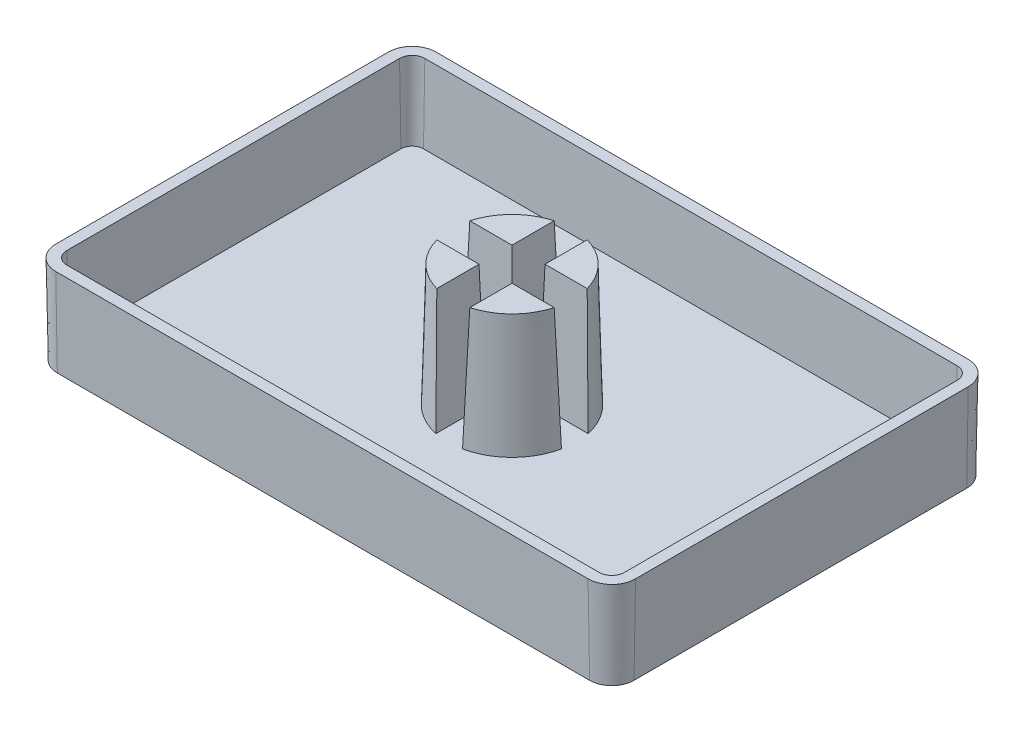
from build123d import *

# Parameters (mm, degrees)
BOSS_EXTRUDE1_DEPTH           = 4
BOSS_EXTRUDE1_DRAFT           = -1
SHELL1_T                      = -0.5
BOSS_EXTRUDE2_DEPTH           = 5.5
BOSS_EXTRUDE2_DRAFT           = 1.5
BOSS_EXTRUDE2_PROFILE_2_DEPTH = 5.5
BOSS_EXTRUDE2_PROFILE_2_DRAFT = 1.5
BOSS_EXTRUDE2_PROFILE_3_DEPTH = 5.5
BOSS_EXTRUDE2_PROFILE_3_DRAFT = 1.5
BOSS_EXTRUDE2_PROFILE_4_DEPTH = 5.5
BOSS_EXTRUDE2_PROFILE_4_DRAFT = 1.5


with BuildPart() as part:
    # Sketch1 → Boss-Extrude1 (with draft: the straight prism first)
    with BuildSketch(Plane(origin=(0, 0, 0), x_dir=(1, 0, 0), z_dir=(0, 1, 0))):
        with BuildLine():
            Line((-12, -8.5), (12, -8.5))
            ThreePointArc((12, -8.5), (12.707106781, -8.207106781), (13, -7.5))
            Line((13, -7.5), (13, 7.5))
            ThreePointArc((13, 7.5), (12.707106781, 8.207106781), (12, 8.5))
            Line((12, 8.5), (-12, 8.5))
            ThreePointArc((-12, 8.5), (-12.707106781, 8.207106781), (-13, 7.5))
            Line((-13, 7.5), (-13, -7.5))
            ThreePointArc((-13, -7.5), (-12.707106781, -8.207106781), (-12, -8.5))
        make_face()
    extrude(amount=BOSS_EXTRUDE1_DEPTH)
    # Boss-Extrude1: the draft: its side faces are tilted about the plane it starts from
    boss_extrude1_sides = [part.faces().sort_by_distance(p)[0] for p in [
        (0, 2, 8.5),
        (12.707106781, 2, 8.207106781),
        (13, 2, 0),
        (12.707106781, 2, -8.207106781),
        (0, 2, -8.5),
        (-12.707106781, 2, -8.207106781),
        (-13, 2, 0),
        (-12.707106781, 2, 8.207106781),
    ]]
    draft(boss_extrude1_sides, Plane(origin=(0, 0, 0), x_dir=(1, 0, 0), z_dir=(0, 1, 0)), BOSS_EXTRUDE1_DRAFT)

    # Shell1
    shell1_openings = [part.faces().sort_by_distance(p)[0] for p in [
        (0, 4, 0),
    ]]
    offset(amount=SHELL1_T, openings=shell1_openings, kind=Kind.INTERSECTION)


with BuildPart() as boss_extrude2_tool:
    # Sketch2 → Boss-Extrude2 (with draft: the straight prism first)
    with BuildSketch(Plane(origin=(0, 0.5, 0), x_dir=(1, 0, 0), z_dir=(0, 1, 0))):
        with BuildLine():
            Line((-0.6, -2.829761289), (-0.6, -0.6))
            Line((-0.6, -0.6), (-2.829761289, -0.6))
            ThreePointArc((-2.829761289, -0.6), (-2.0454277, -2.0454277), (-0.6, -2.829761289))
        make_face()
    extrude(amount=BOSS_EXTRUDE2_DEPTH)
    # Boss-Extrude2: the draft: its side faces are tilted about the plane it starts from
    boss_extrude2_sides = [boss_extrude2_tool.faces().sort_by_distance(p)[0] for p in [
        (-0.6, 3.25, 1.714880645),
        (-1.714880645, 3.25, 0.6),
        (-2.0454277, 3.25, 2.0454277),
    ]]
    draft(boss_extrude2_sides, Plane(origin=(0, 0.5, 0), x_dir=(1, 0, 0), z_dir=(0, 1, 0)), BOSS_EXTRUDE2_DRAFT)


with BuildPart() as part_1:
    add(part.part)

    # Boss-Extrude2: add boss_extrude2_tool
    add(boss_extrude2_tool.part)


with BuildPart() as boss_extrude2_profile_2_tool:
    # Sketch2 → Boss-Extrude2 profile 2 (with draft: the straight prism first)
    with BuildSketch(Plane(origin=(0, 0.5, 0), x_dir=(1, 0, 0), z_dir=(0, 1, 0))):
        with BuildLine():
            ThreePointArc((2.829761289, 0.6), (2.0454277, 2.0454277), (0.6, 2.829761289))
            Line((0.6, 2.829761289), (0.6, 0.6))
            Line((0.6, 0.6), (2.829761289, 0.6))
        make_face()
    extrude(amount=BOSS_EXTRUDE2_PROFILE_2_DEPTH)
    # Boss-Extrude2 profile 2: the draft: its side faces are tilted about the plane it starts from
    boss_extrude2_profile_2_sides = [boss_extrude2_profile_2_tool.faces().sort_by_distance(p)[0] for p in [
        (2.0454277, 3.25, -2.0454277),
        (0.6, 3.25, -1.714880645),
        (1.714880645, 3.25, -0.6),
    ]]
    draft(boss_extrude2_profile_2_sides, Plane(origin=(0, 0.5, 0), x_dir=(1, 0, 0), z_dir=(0, 1, 0)), BOSS_EXTRUDE2_PROFILE_2_DRAFT)


with BuildPart() as part_2:
    add(part_1.part)

    # Boss-Extrude2 profile 2: add boss_extrude2_profile_2_tool
    add(boss_extrude2_profile_2_tool.part)


with BuildPart() as boss_extrude2_profile_3_tool:
    # Sketch2 → Boss-Extrude2 profile 3 (with draft: the straight prism first)
    with BuildSketch(Plane(origin=(0, 0.5, 0), x_dir=(1, 0, 0), z_dir=(0, 1, 0))):
        with BuildLine():
            Line((2.829761289, -0.6), (0.6, -0.6))
            Line((0.6, -0.6), (0.6, -2.829761289))
            ThreePointArc((0.6, -2.829761289), (2.0454277, -2.0454277), (2.829761289, -0.6))
        make_face()
    extrude(amount=BOSS_EXTRUDE2_PROFILE_3_DEPTH)
    # Boss-Extrude2 profile 3: the draft: its side faces are tilted about the plane it starts from
    boss_extrude2_profile_3_sides = [boss_extrude2_profile_3_tool.faces().sort_by_distance(p)[0] for p in [
        (1.714880645, 3.25, 0.6),
        (0.6, 3.25, 1.714880645),
        (2.0454277, 3.25, 2.0454277),
    ]]
    draft(boss_extrude2_profile_3_sides, Plane(origin=(0, 0.5, 0), x_dir=(1, 0, 0), z_dir=(0, 1, 0)), BOSS_EXTRUDE2_PROFILE_3_DRAFT)


with BuildPart() as part_3:
    add(part_2.part)

    # Boss-Extrude2 profile 3: add boss_extrude2_profile_3_tool
    add(boss_extrude2_profile_3_tool.part)


with BuildPart() as boss_extrude2_profile_4_tool:
    # Sketch2 → Boss-Extrude2 profile 4 (with draft: the straight prism first)
    with BuildSketch(Plane(origin=(0, 0.5, 0), x_dir=(1, 0, 0), z_dir=(0, 1, 0))):
        with BuildLine():
            Line((-0.6, 0.6), (-0.6, 2.829761289))
            ThreePointArc((-0.6, 2.829761289), (-2.0454277, 2.0454277), (-2.829761289, 0.6))
            Line((-2.829761289, 0.6), (-0.6, 0.6))
        make_face()
    extrude(amount=BOSS_EXTRUDE2_PROFILE_4_DEPTH)
    # Boss-Extrude2 profile 4: the draft: its side faces are tilted about the plane it starts from
    boss_extrude2_profile_4_sides = [boss_extrude2_profile_4_tool.faces().sort_by_distance(p)[0] for p in [
        (-1.714880645, 3.25, -0.6),
        (-0.6, 3.25, -1.714880645),
        (-2.0454277, 3.25, -2.0454277),
    ]]
    draft(boss_extrude2_profile_4_sides, Plane(origin=(0, 0.5, 0), x_dir=(1, 0, 0), z_dir=(0, 1, 0)), BOSS_EXTRUDE2_PROFILE_4_DRAFT)


with BuildPart() as part_4:
    add(part_3.part)

    # Boss-Extrude2 profile 4: add boss_extrude2_profile_4_tool
    add(boss_extrude2_profile_4_tool.part)


solid = part_4.part
